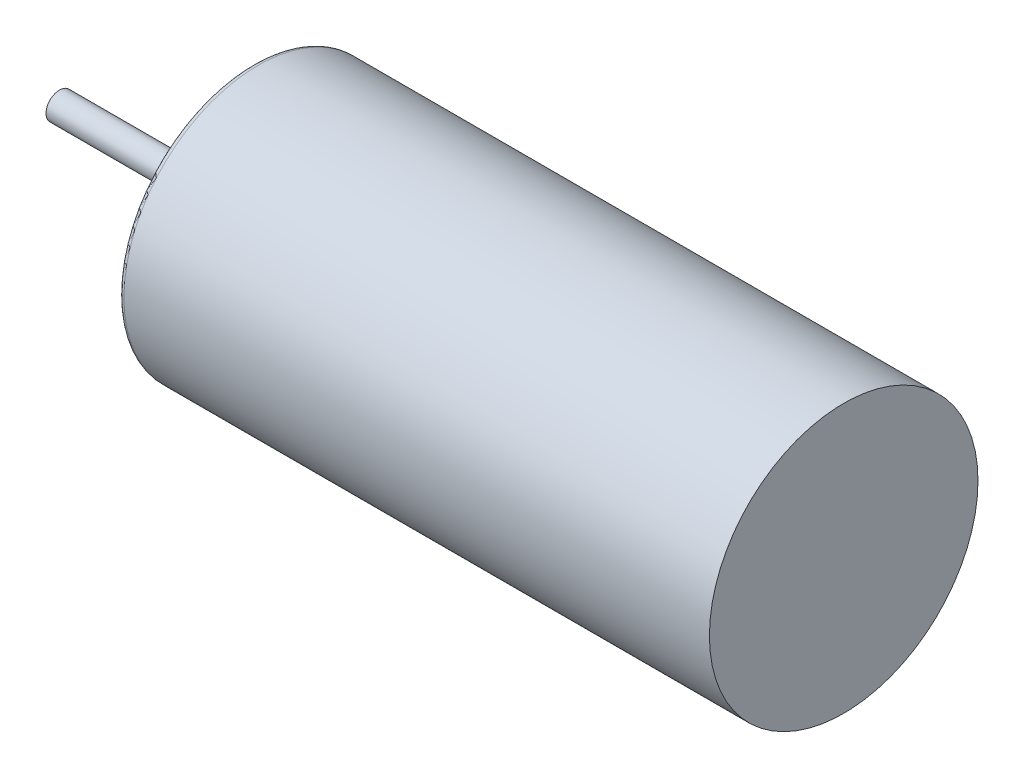
from build123d import *

# Parameters (mm, degrees)
ESBO_O2_R                = 5
RESSALTO_EXTRUS_O1_DEPTH = 22
ESBO_O3_R                = 0.5
RESSALTO_EXTRUS_O2_DEPTH = 7.2
ESBO_O4_R                = 1
RESSALTO_EXTRUS_O3_DEPTH = 0.5
FILETE1_R                = 0.2


with BuildPart() as part:
    # Esboço2 → Ressalto-extrusão1 (new body)
    with BuildSketch(Plane(origin=(0, 0, 0), x_dir=(0, 0, -1), z_dir=(1, 0, 0))):
        Circle(ESBO_O2_R)
    extrude(amount=-RESSALTO_EXTRUS_O1_DEPTH)

    # Esboço3 → Ressalto-extrusão2 (add)
    with BuildSketch(Plane.ZY.offset(22)):
        Circle(ESBO_O3_R)
    extrude(amount=RESSALTO_EXTRUS_O2_DEPTH)

    # Esboço4 → Ressalto-extrusão3 (add)
    with BuildSketch(Plane.ZY.offset(22)):
        Circle(ESBO_O4_R)
    extrude(amount=RESSALTO_EXTRUS_O3_DEPTH)

    # Filete1
    filete1_edges = [part.edges().sort_by_distance(p)[0] for p in [
        (-22, 0, 5),
    ]]
    fillet(filete1_edges, radius=FILETE1_R)


solid = part.part
